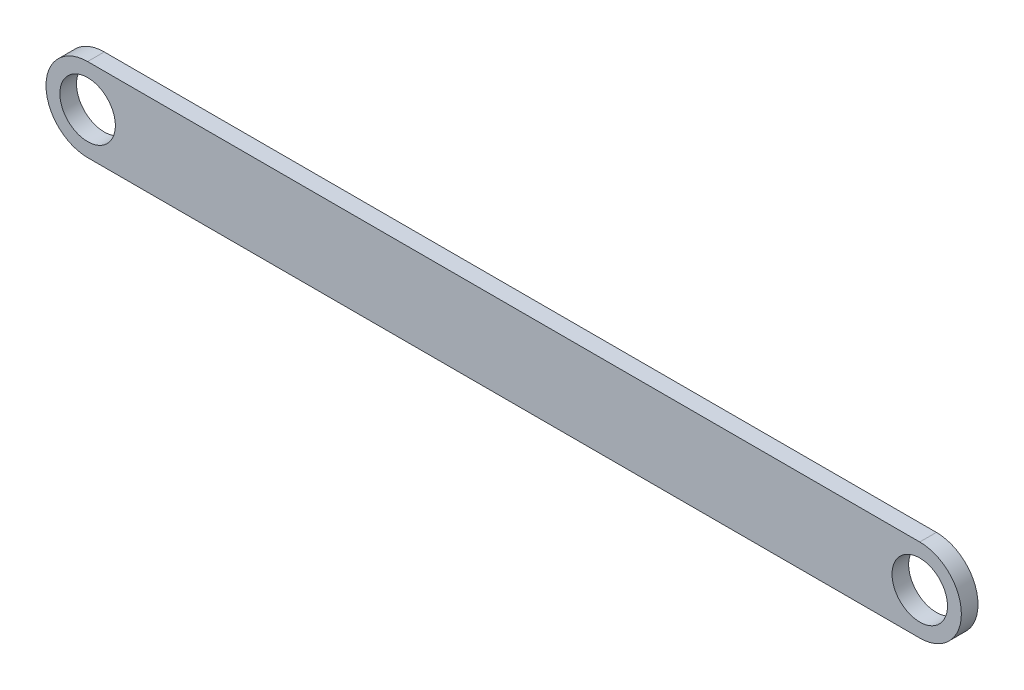
from build123d import *

# Parameters (mm, degrees)
SKETCH1_R           = 5
BOSS_EXTRUDE1_DEPTH = 3


with BuildPart() as part:
    # Sketch1 → Boss-Extrude1 (new body)
    with BuildSketch(Plane.XY):
        with BuildLine():
            Line((75, -7.5), (-75, -7.5))
            ThreePointArc((-75, -7.5), (-82.5, 0), (-75, 7.5))
            Line((-75, 7.5), (75, 7.5))
            ThreePointArc((75, 7.5), (82.5, 0), (75, -7.5))
        make_face()
        with Locations((75, 0)):
            Circle(SKETCH1_R, mode=Mode.SUBTRACT)
        with Locations((-75, 0)):
            Circle(SKETCH1_R, mode=Mode.SUBTRACT)
    extrude(amount=BOSS_EXTRUDE1_DEPTH)


solid = part.part
